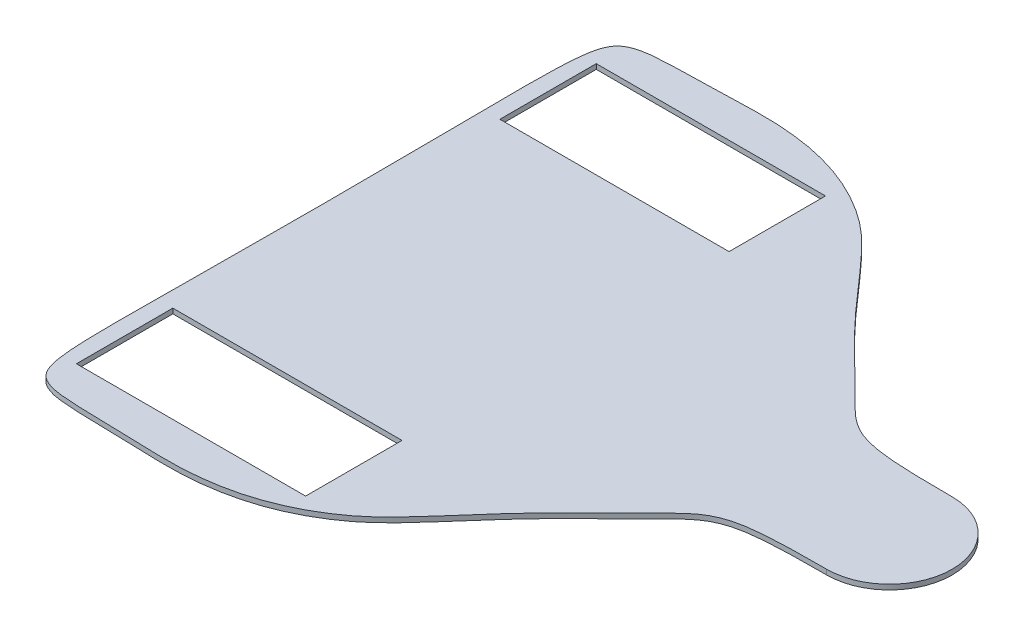
from build123d import *

# Parameters (mm, degrees)
BOSS_EXTRUDE1_DEPTH = 1.2
SKETCH2_W           = 54.8
SKETCH2_H           = 23.05
CUT_EXTRUDE1_DEPTH  = 154.667274543


with BuildPart() as part:
    # base dimensions → Boss-Extrude1 (new body)
    with BuildSketch(Plane(origin=(0, 0, 0), x_dir=(1, 0, 0), z_dir=(0, 1, 0))):
        with BuildLine():
            ThreePointArc((0, -15), (15, 0), (0, 15))
            add(Edge.make_bspline(
                [(0, 15), (-26.059666114, 15), (-24.298419505, 16.87620625), (-51.00856213, 41.98152431), (-61.289566768, 55.94473541), (-79.953121155, 69.692083036), (-95.015762161, 71.716255609), (-110.818983437, 71.005231253), (-126.52199389, 70.874100177), (-138.142838543, 68.217935499), (-135.85, 61.151104159), (-135.85, -61.151104159), (-138.142838543, -68.217935499), (-126.52199389, -70.874100177), (-110.818983437, -71.005231253), (-95.015762161, -71.716255609), (-79.953121155, -69.692083036), (-61.289566768, -55.94473541), (-51.00856213, -41.98152431), (-24.298419505, -16.87620625), (-26.059666114, -15), (0, -15)],
                knots=[0, 0, 0, 0, 0.141137685, 0.170317061, 0.278296352, 0.317035273, 0.518967354, 0.554462651, 0.636492949, 0.682072063, 1, 1, 1.317927937, 1.363507051, 1.445537349, 1.481032646, 1.682964727, 1.721703648, 1.829682939, 1.858862315, 2, 2, 2, 2], degree=3))
        make_face()
    extrude(amount=-BOSS_EXTRUDE1_DEPTH)

    # Sketch2 → Cut-Extrude1 (cut, through all)
    with BuildSketch(Plane(origin=(0, -1.2, 0), x_dir=(-1, 0, 0), z_dir=(0, -1, 0))):
        with Locations((104.85, 50.625)):
            Rectangle(SKETCH2_W, SKETCH2_H)
        with Locations((104.85, -50.625)):
            Rectangle(SKETCH2_W, SKETCH2_H)
    extrude(amount=-CUT_EXTRUDE1_DEPTH, mode=Mode.SUBTRACT)


solid = part.part
